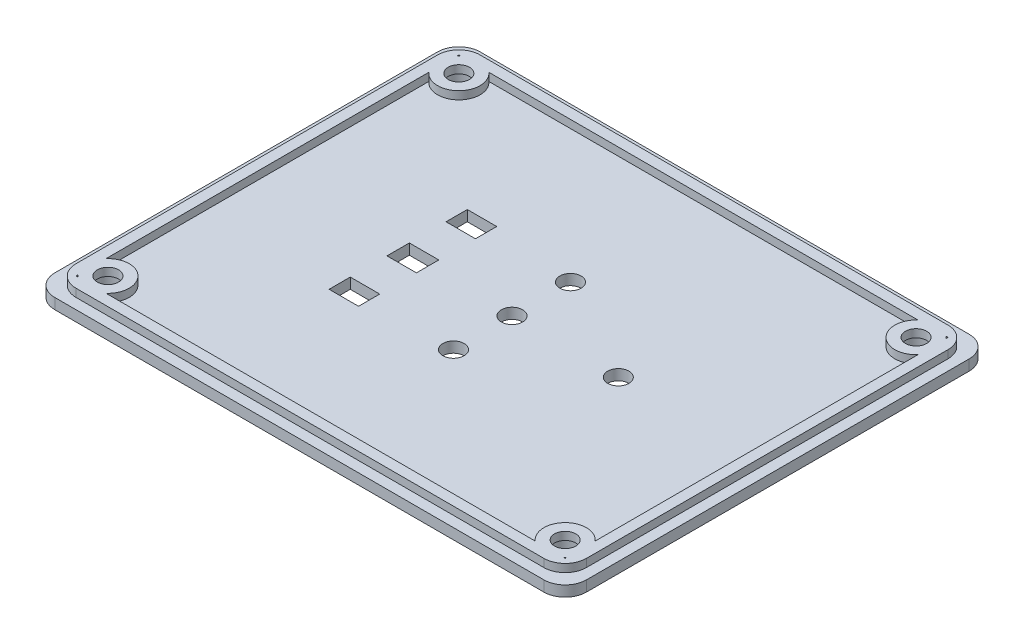
from build123d import *

# Parameters (mm, degrees)
SKETCH1_W           = 100
SKETCH1_H           = 80
BOSS_EXTRUDE2_DEPTH = 2
SKETCH3_W           = 96
SKETCH3_H           = 76
BOSS_EXTRUDE3_DEPTH = 1.5
SKETCH5_R           = 2
CUT_EXTRUDE1_DEPTH  = 35
SHELL1_START        = 2
SHELL1_DEPTH        = 1.5
FILLET1_R           = 4
FILLET2_R           = 4
FILLET3_R           = 4
SKETCH10_R          = 2
SKETCH10_W          = 5.536600299
SKETCH10_H          = 4
SKETCH10_H_2        = 4.208329991
SKETCH10_H_3        = 3.982444476
CUT_EXTRUDE2_DEPTH  = 5
SKETCH11_R          = 2.6
CUT_EXTRUDE3_DEPTH  = 2


# Read off the part's stored shape, not the designer's step: Shell1
with BuildPart() as part:
    # Sketch1 → Boss-Extrude2 (new body)
    with BuildSketch(Plane(origin=(0, 0, 0), x_dir=(1, 0, 0), z_dir=(0, 1, 0))):
        Rectangle(SKETCH1_W, SKETCH1_H)
    extrude(amount=BOSS_EXTRUDE2_DEPTH)

    # Sketch3 → Boss-Extrude3 (add)
    with BuildSketch(Plane(origin=(0, 2, 0), x_dir=(1, 0, 0), z_dir=(0, 1, 0))):
        Rectangle(SKETCH3_W, SKETCH3_H)
    extrude(amount=BOSS_EXTRUDE3_DEPTH)

    # Sketch5 → Cut-Extrude1 (cut)
    with BuildSketch(Plane(origin=(0, 3.5, 0), x_dir=(1, 0, 0), z_dir=(0, 1, 0))):
        with Locations(Location((-43, -33, 0), (0, 0, 270))):
            Circle(SKETCH5_R)
        with Locations(Location((-43, 33, 0), (0, 0, 270))):
            Circle(SKETCH5_R)
        with Locations(Location((43, -33, 0), (0, 0, 270))):
            Circle(SKETCH5_R)
        with Locations(Location((43, 33, 0), (0, 0, 270))):
            Circle(SKETCH5_R)
    extrude(amount=-CUT_EXTRUDE1_DEPTH, mode=Mode.SUBTRACT)

    # Shell1 outline → Shell1 (cut)
    with BuildSketch(Plane(origin=(0, 0, 0), x_dir=(1, 0, 0), z_dir=(0, 1, 0)).offset(SHELL1_START)):
        with BuildLine():
            ThreePointArc((-46, 35.645751311), (-45.828427125, 35.828427125), (-45.645751311, 36))
            Line((-45.645751311, 36), (-46, 36))
            Line((-46, 36), (-46, 35.645751311))
        make_face()
        with BuildLine():
            ThreePointArc((-40.354248689, 36), (-40.171572875, 30.171572875), (-46, 30.354248689))
            Line((-46, 30.354248689), (-46, -30.354248689))
            ThreePointArc((-46, -30.354248689), (-40.171572875, -30.171572875), (-40.354248689, -36))
            Line((-40.354248689, -36), (40.354248689, -36))
            ThreePointArc((40.354248689, -36), (40.171572875, -30.171572875), (46, -30.354248689))
            Line((46, -30.354248689), (46, 30.354248689))
            ThreePointArc((46, 30.354248689), (40.171572875, 30.171572875), (40.354248689, 36))
            Line((40.354248689, 36), (-40.354248689, 36))
        make_face()
        with BuildLine():
            Line((46, 36), (45.645751311, 36))
            ThreePointArc((45.645751311, 36), (45.828427125, 35.828427125), (46, 35.645751311))
            Line((46, 35.645751311), (46, 36))
        make_face()
        with BuildLine():
            Line((-46, -35.645751311), (-46, -36))
            Line((-46, -36), (-45.645751311, -36))
            ThreePointArc((-45.645751311, -36), (-45.828427125, -35.828427125), (-46, -35.645751311))
        make_face()
        with BuildLine():
            ThreePointArc((46, -35.645751311), (45.828427125, -35.828427125), (45.645751311, -36))
            Line((45.645751311, -36), (46, -36))
            Line((46, -36), (46, -35.645751311))
        make_face()
    extrude(amount=SHELL1_DEPTH, mode=Mode.SUBTRACT)

    # Fillet1
    fillet1_edges = [part.edges().sort_by_distance(p)[0] for p in [
        (-48, 2.75, 38),
    ]]
    fillet(fillet1_edges, radius=FILLET1_R)

    # Fillet2
    fillet2_edges = [part.edges().sort_by_distance(p)[0] for p in [
        (48, 2.75, 38),
        (48, 2.75, -38),
        (-48, 2.75, -38),
    ]]
    fillet(fillet2_edges, radius=FILLET2_R)

    # Fillet3
    fillet3_edges = [part.edges().sort_by_distance(p)[0] for p in [
        (-50, 1, -40),
        (50, 1, -40),
        (50, 1, 40),
        (-50, 1, 40),
    ]]
    fillet(fillet3_edges, radius=FILLET3_R)

    # Sketch10 → Cut-Extrude2 (cut)
    with BuildSketch(Plane.XZ):
        with Locations(Location((0, -11, 0), (0, 0, 270))):
            Circle(SKETCH10_R)
        with Locations(Location((0, 0, 0), (0, 0, 270))):
            Circle(SKETCH10_R)
        with Locations(Location((0, 11, 0), (0, 0, 270))):
            Circle(SKETCH10_R)
        with Locations(Location((20, 0, 0), (0, 0, 270))):
            Circle(SKETCH10_R)
        with Locations((-18.761111615, -11.119893759)):
            Rectangle(SKETCH10_W, SKETCH10_H)
        with Locations((-18.761111615, -0.119893758)):
            Rectangle(SKETCH10_W, SKETCH10_H_2)
        with Locations((-18.761111615, 10.880106241)):
            Rectangle(SKETCH10_W, SKETCH10_H_3)
    extrude(amount=-CUT_EXTRUDE2_DEPTH, mode=Mode.SUBTRACT)

    # Sketch11 → Cut-Extrude3 (cut)
    with BuildSketch(Plane.XZ):
        with Locations(Location((43, 33, 0), (0, 0, 270))):
            Circle(SKETCH11_R)
        with Locations(Location((43, -33, 0), (0, 0, 270))):
            Circle(SKETCH11_R)
        with Locations(Location((-43, -33, 0), (0, 0, 270))):
            Circle(SKETCH11_R)
        with Locations(Location((-43, 33, 0), (0, 0, 270))):
            Circle(SKETCH11_R)
    extrude(amount=-CUT_EXTRUDE3_DEPTH, mode=Mode.SUBTRACT)


solid = part.part
